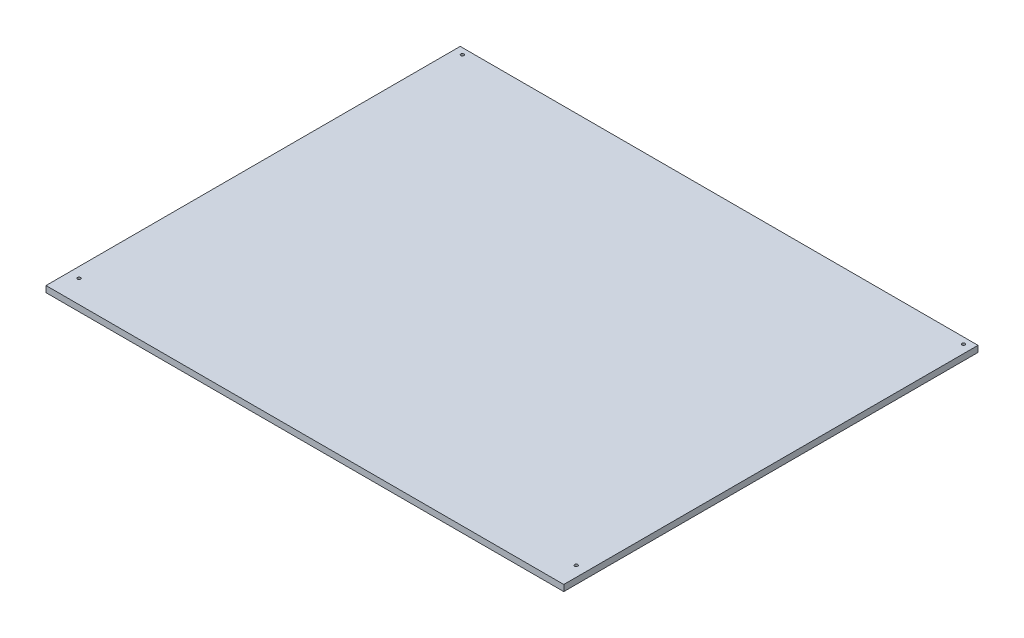
from build123d import *

# Parameters (mm, degrees)
SKETCH1_W           = 500
SKETCH1_H           = 400
SKETCH1_R           = 1.5
SKETCH1_R_2         = 1.525
BOSS_EXTRUDE1_DEPTH = 6


with BuildPart() as part:
    # Sketch1 → Boss-Extrude1 (new body)
    with BuildSketch(Plane(origin=(0, 0, 0), x_dir=(1, 0, 0), z_dir=(0, 1, 0))):
        with Locations((250, -200)):
            Rectangle(SKETCH1_W, SKETCH1_H)
        with Locations((490, -378)):
            Circle(SKETCH1_R, mode=Mode.SUBTRACT)
        with Locations((10, -378)):
            Circle(SKETCH1_R, mode=Mode.SUBTRACT)
        with Locations((8, -6)):
            Circle(SKETCH1_R, mode=Mode.SUBTRACT)
        with Locations((492, -6)):
            Circle(SKETCH1_R_2, mode=Mode.SUBTRACT)
    extrude(amount=BOSS_EXTRUDE1_DEPTH)


solid = part.part
